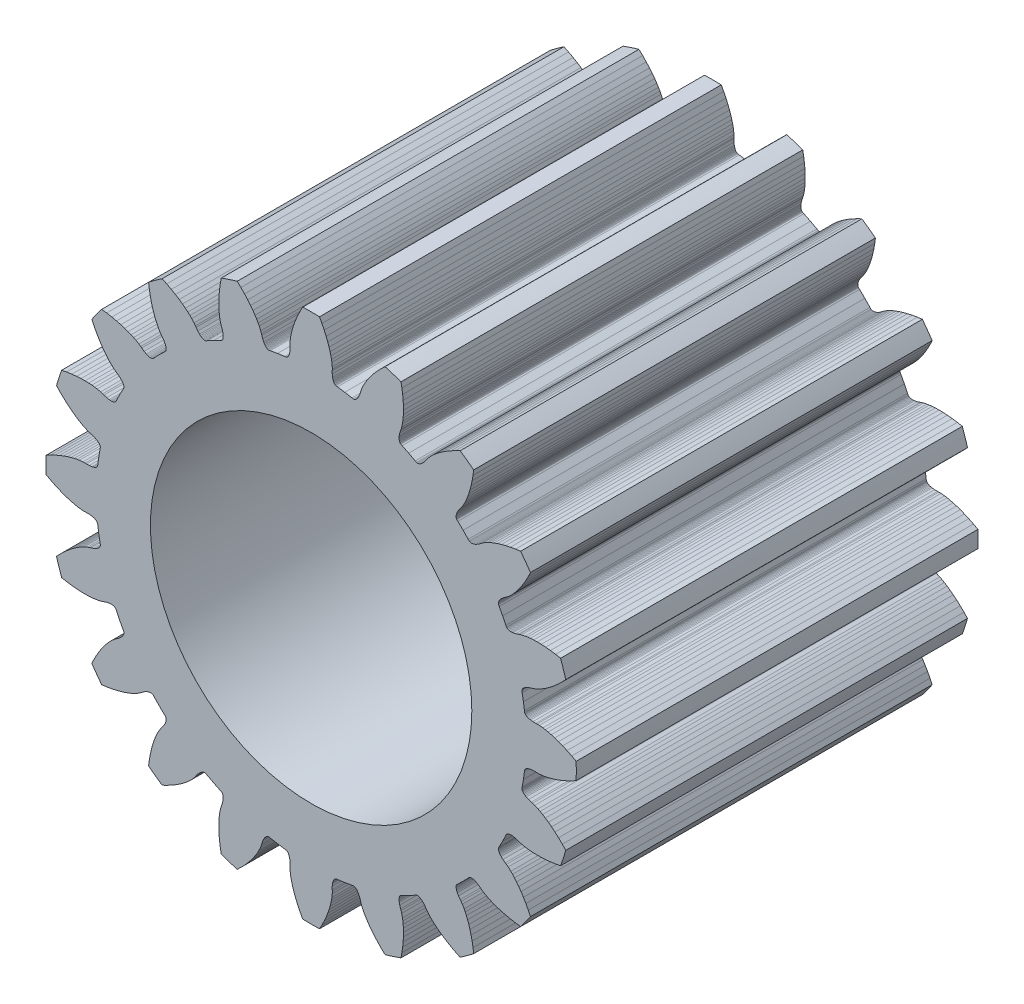
from build123d import *

# Parameters (mm, degrees)
MODEL_R             = 4
BOSS_EXTRUDE1_DEPTH = 10


with BuildPart() as part:
    # Model → Boss-Extrude1 (new body)
    with BuildSketch(Plane.XY):
        with BuildLine():
            Line((6.158306, 1.6585407), (6.2511574, 1.7486857))
            Line((6.2511574, 1.7486857), (6.338222535, 1.840329509))
            ThreePointArc((6.338222535, 1.840329509), (6.276964201, 2.03950926), (6.209448333, 2.236655815))
            Line((6.209448333, 2.236655815), (6.0851442, 2.2596217))
            Line((6.0851442, 2.2596217), (5.95704, 2.2779739))
            Line((5.95704, 2.2779739), (5.8378792, 2.2899852))
            Line((5.8378792, 2.2899852), (5.7281972, 2.2964334))
            Line((5.7281972, 2.2964334), (5.6286184, 2.2981193))
            Line((5.6286184, 2.2981193), (5.5383984, 2.295887))
            Line((5.5383984, 2.295887), (5.4581037, 2.2905413))
            Line((5.4581037, 2.2905413), (5.387621, 2.2828551))
            Line((5.387621, 2.2828551), (5.32769, 2.2737776))
            Line((5.32769, 2.2737776), (5.2396886, 2.2550103))
            Line((5.2396886, 2.2550103), (5.1873797, 2.2392778))
            Line((5.1873797, 2.2392778), (5.1564677, 2.2274555))
            Line((5.1564677, 2.2274555), (5.0880864, 2.205711))
            Line((5.0880864, 2.205711), (5.0271926, 2.1932586))
            Line((5.0271926, 2.1932586), (4.9997687, 2.1903178))
            Line((4.9997687, 2.1903178), (4.9744535, 2.189428))
            Line((4.9744535, 2.189428), (4.9513281, 2.1905181))
            Line((4.9513281, 2.1905181), (4.9304513, 2.1934947))
            Line((4.9304513, 2.1934947), (4.9119089, 2.1982555))
            Line((4.9119089, 2.1982555), (4.8957509, 2.2047026))
            Line((4.8957509, 2.2047026), (4.8820538, 2.2127515))
            Line((4.8820538, 2.2127515), (4.8708545, 2.2222864))
            Line((4.8708545, 2.2222864), (4.862234, 2.2332138))
            Line((4.862234, 2.2332138), (4.8470396, 2.2647084))
            Line((4.8470396, 2.2647084), (4.7668849, 2.4288492))
            Line((4.7668849, 2.4288492), (4.681206, 2.5901752))
            Line((4.681206, 2.5901752), (4.6646573, 2.6209798))
            Line((4.6646573, 2.6209798), (4.6608839, 2.6343769))
            Line((4.6608839, 2.6343769), (4.6597528, 2.6490418))
            Line((4.6597528, 2.6490418), (4.661292, 2.664854))
            Line((4.661292, 2.664854), (4.6655737, 2.6817156))
            Line((4.6655737, 2.6817156), (4.672621, 2.6995151))
            Line((4.672621, 2.6995151), (4.682484, 2.7181543))
            Line((4.682484, 2.7181543), (4.6951948, 2.7375039))
            Line((4.6951948, 2.7375039), (4.7107946, 2.7574613))
            Line((4.7107946, 2.7574613), (4.7292932, 2.7779192))
            Line((4.7292932, 2.7779192), (4.7751598, 2.819864))
            Line((4.7751598, 2.819864), (4.832945, 2.8624045))
            Line((4.832945, 2.8624045), (4.8606791, 2.8804639))
            Line((4.8606791, 2.8804639), (4.9041533, 2.9135354))
            Line((4.9041533, 2.9135354), (4.9710623, 2.9736988))
            Line((4.9710623, 2.9736988), (5.0136327, 3.0168484))
            Line((5.0136327, 3.0168484), (5.0612797, 3.0693523))
            Line((5.0612797, 3.0693523), (5.1128005, 3.1311699))
            Line((5.1128005, 3.1311699), (5.1676364, 3.2028473))
            Line((5.1676364, 3.2028473), (5.2248034, 3.2843992))
            Line((5.2248034, 3.2843992), (5.2840562, 3.376924))
            Line((5.2840562, 3.376924), (5.3443798, 3.4803872))
            Line((5.3443798, 3.4803872), (5.4048304, 3.5948128))
            Line((5.4048304, 3.5948128), (5.459314676, 3.708875777))
            ThreePointArc((5.459314676, 3.708875777), (5.339504611, 3.879377111), (5.214371574, 4.046011081))
            Line((5.214371574, 4.046011081), (5.0890546, 4.0294409))
            Line((5.0890546, 4.0294409), (4.9615491, 4.0073085))
            Line((4.9615491, 4.0073085), (4.8445088, 3.9819092))
            Line((4.8445088, 3.9819092), (4.7382023, 3.9541482))
            Line((4.7382023, 3.9541482), (4.6429763, 3.92498))
            Line((4.6429763, 3.92498), (4.5578618, 3.8949775))
            Line((4.5578618, 3.8949775), (4.4831489, 3.865081))
            Line((4.4831489, 3.865081), (4.4184911, 3.8359906))
            Line((4.4184911, 3.8359906), (4.3642984, 3.8088377))
            Line((4.3642984, 3.8088377), (4.2864035, 3.763795))
            Line((4.2864035, 3.763795), (4.2415164, 3.7326682))
            Line((4.2415164, 3.7326682), (4.2157706, 3.7118722))
            Line((4.2157706, 3.7118722), (4.1574555, 3.670061))
            Line((4.1574555, 3.670061), (4.1033901, 3.6394008))
            Line((4.1033901, 3.6394008), (4.0782171, 3.6281295))
            Line((4.0782171, 3.6281295), (4.0544159, 3.6194604))
            Line((4.0544159, 3.6194604), (4.0320855, 3.613351))
            Line((4.0320855, 3.613351), (4.0113107, 3.6097306))
            Line((4.0113107, 3.6097306), (3.9922047, 3.6085285))
            Line((3.9922047, 3.6085285), (3.9748452, 3.609667))
            Line((3.9748452, 3.609667), (3.9593313, 3.6130894))
            Line((3.9593313, 3.6130894), (3.9457336, 3.6186967))
            Line((3.9457336, 3.6186967), (3.9341583, 3.6264254))
            Line((3.9341583, 3.6264254), (3.9099752, 3.6516833))
            Line((3.9099752, 3.6516833), (3.7830213, 3.7830213))
            Line((3.7830213, 3.7830213), (3.6516833, 3.9099752))
            Line((3.6516833, 3.9099752), (3.6264254, 3.9341583))
            Line((3.6264254, 3.9341583), (3.6186967, 3.9457336))
            Line((3.6186967, 3.9457336), (3.6130894, 3.9593313))
            Line((3.6130894, 3.9593313), (3.609667, 3.9748452))
            Line((3.609667, 3.9748452), (3.6085285, 3.9922047))
            Line((3.6085285, 3.9922047), (3.6097306, 4.0113107))
            Line((3.6097306, 4.0113107), (3.613351, 4.0320855))
            Line((3.613351, 4.0320855), (3.6194604, 4.0544159))
            Line((3.6194604, 4.0544159), (3.6281295, 4.0782171))
            Line((3.6281295, 4.0782171), (3.6394008, 4.1033901))
            Line((3.6394008, 4.1033901), (3.670061, 4.1574555))
            Line((3.670061, 4.1574555), (3.7118722, 4.2157706))
            Line((3.7118722, 4.2157706), (3.7326682, 4.2415164))
            Line((3.7326682, 4.2415164), (3.763795, 4.2864035))
            Line((3.763795, 4.2864035), (3.8088377, 4.3642984))
            Line((3.8088377, 4.3642984), (3.8359906, 4.4184911))
            Line((3.8359906, 4.4184911), (3.865081, 4.4831489))
            Line((3.865081, 4.4831489), (3.8949775, 4.5578618))
            Line((3.8949775, 4.5578618), (3.92498, 4.6429763))
            Line((3.92498, 4.6429763), (3.9541482, 4.7382023))
            Line((3.9541482, 4.7382023), (3.9819092, 4.8445088))
            Line((3.9819092, 4.8445088), (4.0073085, 4.9615491))
            Line((4.0073085, 4.9615491), (4.0294409, 5.0890546))
            Line((4.0294409, 5.0890546), (4.046011181, 5.214371574))
            ThreePointArc((4.046011181, 5.214371574), (3.879377227, 5.339504632), (3.708875877, 5.459314676))
            Line((3.708875877, 5.459314676), (3.5948128, 5.4048304))
            Line((3.5948128, 5.4048304), (3.4803872, 5.3443798))
            Line((3.4803872, 5.3443798), (3.376924, 5.2840562))
            Line((3.376924, 5.2840562), (3.2843992, 5.2248034))
            Line((3.2843992, 5.2248034), (3.2028473, 5.1676364))
            Line((3.2028473, 5.1676364), (3.1311699, 5.1128005))
            Line((3.1311699, 5.1128005), (3.0693523, 5.0612797))
            Line((3.0693523, 5.0612797), (3.0168484, 5.0136327))
            Line((3.0168484, 5.0136327), (2.9736988, 4.9710623))
            Line((2.9736988, 4.9710623), (2.9135354, 4.9041533))
            Line((2.9135354, 4.9041533), (2.8804639, 4.8606791))
            Line((2.8804639, 4.8606791), (2.8624045, 4.832945))
            Line((2.8624045, 4.832945), (2.819864, 4.7751598))
            Line((2.819864, 4.7751598), (2.7779192, 4.7292932))
            Line((2.7779192, 4.7292932), (2.7574613, 4.7107946))
            Line((2.7574613, 4.7107946), (2.7375039, 4.6951948))
            Line((2.7375039, 4.6951948), (2.7181543, 4.682484))
            Line((2.7181543, 4.682484), (2.6995151, 4.672621))
            Line((2.6995151, 4.672621), (2.6817156, 4.6655737))
            Line((2.6817156, 4.6655737), (2.664854, 4.661292))
            Line((2.664854, 4.661292), (2.6490418, 4.6597528))
            Line((2.6490418, 4.6597528), (2.6343769, 4.6608839))
            Line((2.6343769, 4.6608839), (2.6209798, 4.6646573))
            Line((2.6209798, 4.6646573), (2.5901752, 4.681206))
            Line((2.5901752, 4.681206), (2.4288492, 4.7668849))
            Line((2.4288492, 4.7668849), (2.2647084, 4.8470396))
            Line((2.2647084, 4.8470396), (2.2332138, 4.862234))
            Line((2.2332138, 4.862234), (2.2222864, 4.8708545))
            Line((2.2222864, 4.8708545), (2.2127515, 4.8820538))
            Line((2.2127515, 4.8820538), (2.2047026, 4.8957509))
            Line((2.2047026, 4.8957509), (2.1982555, 4.9119089))
            Line((2.1982555, 4.9119089), (2.1934947, 4.9304513))
            Line((2.1934947, 4.9304513), (2.1905181, 4.9513281))
            Line((2.1905181, 4.9513281), (2.189428, 4.9744535))
            Line((2.189428, 4.9744535), (2.1903178, 4.9997687))
            Line((2.1903178, 4.9997687), (2.1932586, 5.0271926))
            Line((2.1932586, 5.0271926), (2.205711, 5.0880864))
            Line((2.205711, 5.0880864), (2.2274555, 5.1564677))
            Line((2.2274555, 5.1564677), (2.2392778, 5.1873797))
            Line((2.2392778, 5.1873797), (2.2550103, 5.2396886))
            Line((2.2550103, 5.2396886), (2.2737776, 5.32769))
            Line((2.2737776, 5.32769), (2.2828551, 5.387621))
            Line((2.2828551, 5.387621), (2.2905413, 5.4581037))
            Line((2.2905413, 5.4581037), (2.295887, 5.5383984))
            Line((2.295887, 5.5383984), (2.2981193, 5.6286184))
            Line((2.2981193, 5.6286184), (2.2964334, 5.7281972))
            Line((2.2964334, 5.7281972), (2.2899852, 5.8378792))
            Line((2.2899852, 5.8378792), (2.2779739, 5.95704))
            Line((2.2779739, 5.95704), (2.2596217, 6.0851442))
            Line((2.2596217, 6.0851442), (2.236655915, 6.209448333))
            ThreePointArc((2.236655915, 6.209448333), (2.039509367, 6.276964221), (1.840329609, 6.338222535))
            Line((1.840329609, 6.338222535), (1.7486857, 6.2511574))
            Line((1.7486857, 6.2511574), (1.6585407, 6.158306))
            Line((1.6585407, 6.158306), (1.5787824, 6.068963))
            Line((1.5787824, 6.068963), (1.5090962, 5.9840185))
            Line((1.5090962, 5.9840185), (1.4492013, 5.9044485))
            Line((1.4492013, 5.9044485), (1.3979773, 5.8301469))
            Line((1.3979773, 5.8301469), (1.355106, 5.762045))
            Line((1.355106, 5.762045), (1.3198956, 5.7005055))
            Line((1.3198956, 5.7005055), (1.2920129, 5.6466847))
            Line((1.2920129, 5.6466847), (1.2554701, 5.5644589))
            Line((1.2554701, 5.5644589), (1.2374515, 5.5128928))
            Line((1.2374515, 5.5128928), (1.2288463, 5.4809355))
            Line((1.2288463, 5.4809355), (1.2062445, 5.4128327))
            Line((1.2062445, 5.4128327), (1.1805262, 5.3562493))
            Line((1.1805262, 5.3562493), (1.1667859, 5.3323343))
            Line((1.1667859, 5.3323343), (1.1526259, 5.3113309))
            Line((1.1526259, 5.3113309), (1.1381513, 5.2932628))
            Line((1.1381513, 5.2932628), (1.1234721, 5.2781227))
            Line((1.1234721, 5.2781227), (1.1087216, 5.2659199))
            Line((1.1087216, 5.2659199), (1.0940083, 5.2566373))
            Line((1.0940083, 5.2566373), (1.0794456, 5.2502872))
            Line((1.0794456, 5.2502872), (1.065149, 5.2468312))
            Line((1.065149, 5.2468312), (1.0512415, 5.24628))
            Line((1.0512415, 5.24628), (1.0168308, 5.2524996))
            Line((1.0168308, 5.2524996), (0.8369244, 5.2841326))
            Line((0.8369244, 5.2841326), (0.656048, 5.309642))
            Line((0.656048, 5.309642), (0.6213996, 5.3143603))
            Line((0.6213996, 5.3143603), (0.6083431, 5.3191821))
            Line((0.6083431, 5.3191821), (0.5958142, 5.3268869))
            Line((0.5958142, 5.3268869), (0.5839265, 5.3374263))
            Line((0.5839265, 5.3374263), (0.5728019, 5.3508013))
            Line((0.5728019, 5.3508013), (0.5625441, 5.366965))
            Line((0.5625441, 5.366965), (0.553262, 5.3859001))
            Line((0.553262, 5.3859001), (0.5450791, 5.4075568))
            Line((0.5450791, 5.4075568), (0.5381026, 5.431908))
            Line((0.5381026, 5.431908), (0.5324249, 5.4588985))
            Line((0.5324249, 5.4588985), (0.5254506, 5.5206599))
            Line((0.5254506, 5.5206599), (0.5249999, 5.5924138))
            Line((0.5249999, 5.5924138), (0.5266912, 5.6254662))
            Line((0.5266912, 5.6254662), (0.5254894, 5.6800765))
            Line((0.5254894, 5.6800765), (0.5161442, 5.7695702))
            Line((0.5161442, 5.7695702), (0.5062577, 5.8293731))
            Line((0.5062577, 5.8293731), (0.4917874, 5.8987813))
            Line((0.4917874, 5.8987813), (0.472059, 5.976798))
            Line((0.472059, 5.976798), (0.4463026, 6.0632921))
            Line((0.4463026, 6.0632921), (0.4139276, 6.1574762))
            Line((0.4139276, 6.1574762), (0.3739014, 6.2597974))
            Line((0.3739014, 6.2597974), (0.3256553, 6.3694144))
            Line((0.3256553, 6.3694144), (0.268615, 6.4855776))
            Line((0.268615, 6.4855776), (0.208361095, 6.596700914))
            ThreePointArc((0.208361095, 6.596700914), (4.6e-08, 6.599990705), (-0.208361003, 6.596700917))
            Line((-0.208361003, 6.596700917), (-0.268615, 6.4855776))
            Line((-0.268615, 6.4855776), (-0.3256553, 6.3694144))
            Line((-0.3256553, 6.3694144), (-0.3739014, 6.2597974))
            Line((-0.3739014, 6.2597974), (-0.4139276, 6.1574762))
            Line((-0.4139276, 6.1574762), (-0.4463026, 6.0632921))
            Line((-0.4463026, 6.0632921), (-0.472059, 5.976798))
            Line((-0.472059, 5.976798), (-0.4917874, 5.8987813))
            Line((-0.4917874, 5.8987813), (-0.5062577, 5.8293731))
            Line((-0.5062577, 5.8293731), (-0.5161442, 5.7695702))
            Line((-0.5161442, 5.7695702), (-0.5254894, 5.6800765))
            Line((-0.5254894, 5.6800765), (-0.5266912, 5.6254662))
            Line((-0.5266912, 5.6254662), (-0.5249999, 5.5924138))
            Line((-0.5249999, 5.5924138), (-0.5254506, 5.5206599))
            Line((-0.5254506, 5.5206599), (-0.5324249, 5.4588985))
            Line((-0.5324249, 5.4588985), (-0.5381026, 5.431908))
            Line((-0.5381026, 5.431908), (-0.5450791, 5.4075568))
            Line((-0.5450791, 5.4075568), (-0.553262, 5.3859001))
            Line((-0.553262, 5.3859001), (-0.5625441, 5.366965))
            Line((-0.5625441, 5.366965), (-0.5728019, 5.3508013))
            Line((-0.5728019, 5.3508013), (-0.5839265, 5.3374263))
            Line((-0.5839265, 5.3374263), (-0.5958142, 5.3268869))
            Line((-0.5958142, 5.3268869), (-0.6083431, 5.3191821))
            Line((-0.6083431, 5.3191821), (-0.6213996, 5.3143603))
            Line((-0.6213996, 5.3143603), (-0.656048, 5.309642))
            Line((-0.656048, 5.309642), (-0.8369244, 5.2841326))
            Line((-0.8369244, 5.2841326), (-1.0168308, 5.2524996))
            Line((-1.0168308, 5.2524996), (-1.0512415, 5.24628))
            Line((-1.0512415, 5.24628), (-1.065149, 5.2468312))
            Line((-1.065149, 5.2468312), (-1.0794456, 5.2502872))
            Line((-1.0794456, 5.2502872), (-1.0940083, 5.2566373))
            Line((-1.0940083, 5.2566373), (-1.1087216, 5.2659199))
            Line((-1.1087216, 5.2659199), (-1.1234721, 5.2781227))
            Line((-1.1234721, 5.2781227), (-1.1381513, 5.2932628))
            Line((-1.1381513, 5.2932628), (-1.1526259, 5.3113309))
            Line((-1.1526259, 5.3113309), (-1.1667859, 5.3323343))
            Line((-1.1667859, 5.3323343), (-1.1805262, 5.3562493))
            Line((-1.1805262, 5.3562493), (-1.2062445, 5.4128327))
            Line((-1.2062445, 5.4128327), (-1.2288463, 5.4809355))
            Line((-1.2288463, 5.4809355), (-1.2374515, 5.5128928))
            Line((-1.2374515, 5.5128928), (-1.2554701, 5.5644589))
            Line((-1.2554701, 5.5644589), (-1.2920129, 5.6466847))
            Line((-1.2920129, 5.6466847), (-1.3198956, 5.7005055))
            Line((-1.3198956, 5.7005055), (-1.355106, 5.762045))
            Line((-1.355106, 5.762045), (-1.3979773, 5.8301469))
            Line((-1.3979773, 5.8301469), (-1.4492013, 5.9044485))
            Line((-1.4492013, 5.9044485), (-1.5090962, 5.9840185))
            Line((-1.5090962, 5.9840185), (-1.5787824, 6.068963))
            Line((-1.5787824, 6.068963), (-1.6585407, 6.158306))
            Line((-1.6585407, 6.158306), (-1.7486857, 6.2511574))
            Line((-1.7486857, 6.2511574), (-1.840329509, 6.338222535))
            ThreePointArc((-1.840329509, 6.338222535), (-2.03950926, 6.276964201), (-2.236655815, 6.209448333))
            Line((-2.236655815, 6.209448333), (-2.2596217, 6.0851442))
            Line((-2.2596217, 6.0851442), (-2.2779739, 5.95704))
            Line((-2.2779739, 5.95704), (-2.2899852, 5.8378792))
            Line((-2.2899852, 5.8378792), (-2.2964334, 5.7281972))
            Line((-2.2964334, 5.7281972), (-2.2981193, 5.6286184))
            Line((-2.2981193, 5.6286184), (-2.295887, 5.5383984))
            Line((-2.295887, 5.5383984), (-2.2905413, 5.4581037))
            Line((-2.2905413, 5.4581037), (-2.2828551, 5.387621))
            Line((-2.2828551, 5.387621), (-2.2737776, 5.32769))
            Line((-2.2737776, 5.32769), (-2.2550103, 5.2396886))
            Line((-2.2550103, 5.2396886), (-2.2392778, 5.1873797))
            Line((-2.2392778, 5.1873797), (-2.2274555, 5.1564677))
            Line((-2.2274555, 5.1564677), (-2.205711, 5.0880864))
            Line((-2.205711, 5.0880864), (-2.1932586, 5.0271926))
            Line((-2.1932586, 5.0271926), (-2.1903178, 4.9997687))
            Line((-2.1903178, 4.9997687), (-2.189428, 4.9744535))
            Line((-2.189428, 4.9744535), (-2.1905181, 4.9513281))
            Line((-2.1905181, 4.9513281), (-2.1934947, 4.9304513))
            Line((-2.1934947, 4.9304513), (-2.1982555, 4.9119089))
            Line((-2.1982555, 4.9119089), (-2.2047026, 4.8957509))
            Line((-2.2047026, 4.8957509), (-2.2127515, 4.8820538))
            Line((-2.2127515, 4.8820538), (-2.2222864, 4.8708545))
            Line((-2.2222864, 4.8708545), (-2.2332138, 4.862234))
            Line((-2.2332138, 4.862234), (-2.2647084, 4.8470396))
            Line((-2.2647084, 4.8470396), (-2.4288492, 4.7668849))
            Line((-2.4288492, 4.7668849), (-2.5901752, 4.681206))
            Line((-2.5901752, 4.681206), (-2.6209798, 4.6646573))
            Line((-2.6209798, 4.6646573), (-2.6343769, 4.6608839))
            Line((-2.6343769, 4.6608839), (-2.6490418, 4.6597528))
            Line((-2.6490418, 4.6597528), (-2.664854, 4.661292))
            Line((-2.664854, 4.661292), (-2.6817156, 4.6655737))
            Line((-2.6817156, 4.6655737), (-2.6995151, 4.672621))
            Line((-2.6995151, 4.672621), (-2.7181543, 4.682484))
            Line((-2.7181543, 4.682484), (-2.7375039, 4.6951948))
            Line((-2.7375039, 4.6951948), (-2.7574613, 4.7107946))
            Line((-2.7574613, 4.7107946), (-2.7779192, 4.7292932))
            Line((-2.7779192, 4.7292932), (-2.819864, 4.7751598))
            Line((-2.819864, 4.7751598), (-2.8624045, 4.832945))
            Line((-2.8624045, 4.832945), (-2.8804639, 4.8606791))
            Line((-2.8804639, 4.8606791), (-2.9135354, 4.9041533))
            Line((-2.9135354, 4.9041533), (-2.9736988, 4.9710623))
            Line((-2.9736988, 4.9710623), (-3.0168484, 5.0136327))
            Line((-3.0168484, 5.0136327), (-3.0693523, 5.0612797))
            Line((-3.0693523, 5.0612797), (-3.1311699, 5.1128005))
            Line((-3.1311699, 5.1128005), (-3.2028473, 5.1676364))
            Line((-3.2028473, 5.1676364), (-3.2843992, 5.2248034))
            Line((-3.2843992, 5.2248034), (-3.376924, 5.2840562))
            Line((-3.376924, 5.2840562), (-3.4803872, 5.3443798))
            Line((-3.4803872, 5.3443798), (-3.5948128, 5.4048304))
            Line((-3.5948128, 5.4048304), (-3.708875777, 5.459314676))
            ThreePointArc((-3.708875777, 5.459314676), (-3.879377111, 5.339504611), (-4.046011081, 5.214371574))
            Line((-4.046011081, 5.214371574), (-4.0294409, 5.0890546))
            Line((-4.0294409, 5.0890546), (-4.0073085, 4.9615491))
            Line((-4.0073085, 4.9615491), (-3.9819092, 4.8445088))
            Line((-3.9819092, 4.8445088), (-3.9541482, 4.7382023))
            Line((-3.9541482, 4.7382023), (-3.92498, 4.6429763))
            Line((-3.92498, 4.6429763), (-3.8949775, 4.5578618))
            Line((-3.8949775, 4.5578618), (-3.865081, 4.4831489))
            Line((-3.865081, 4.4831489), (-3.8359906, 4.4184911))
            Line((-3.8359906, 4.4184911), (-3.8088377, 4.3642984))
            Line((-3.8088377, 4.3642984), (-3.763795, 4.2864035))
            Line((-3.763795, 4.2864035), (-3.7326682, 4.2415164))
            Line((-3.7326682, 4.2415164), (-3.7118722, 4.2157706))
            Line((-3.7118722, 4.2157706), (-3.670061, 4.1574555))
            Line((-3.670061, 4.1574555), (-3.6394008, 4.1033901))
            Line((-3.6394008, 4.1033901), (-3.6281295, 4.0782171))
            Line((-3.6281295, 4.0782171), (-3.6194604, 4.0544159))
            Line((-3.6194604, 4.0544159), (-3.613351, 4.0320855))
            Line((-3.613351, 4.0320855), (-3.6097306, 4.0113107))
            Line((-3.6097306, 4.0113107), (-3.6085285, 3.9922047))
            Line((-3.6085285, 3.9922047), (-3.609667, 3.9748452))
            Line((-3.609667, 3.9748452), (-3.6130894, 3.9593313))
            Line((-3.6130894, 3.9593313), (-3.6186967, 3.9457336))
            Line((-3.6186967, 3.9457336), (-3.6264254, 3.9341583))
            Line((-3.6264254, 3.9341583), (-3.6516833, 3.9099752))
            Line((-3.6516833, 3.9099752), (-3.7830213, 3.7830213))
            Line((-3.7830213, 3.7830213), (-3.9099752, 3.6516833))
            Line((-3.9099752, 3.6516833), (-3.9341583, 3.6264254))
            Line((-3.9341583, 3.6264254), (-3.9457336, 3.6186967))
            Line((-3.9457336, 3.6186967), (-3.9593313, 3.6130894))
            Line((-3.9593313, 3.6130894), (-3.9748452, 3.609667))
            Line((-3.9748452, 3.609667), (-3.9922047, 3.6085285))
            Line((-3.9922047, 3.6085285), (-4.0113107, 3.6097306))
            Line((-4.0113107, 3.6097306), (-4.0320855, 3.613351))
            Line((-4.0320855, 3.613351), (-4.0544159, 3.6194604))
            Line((-4.0544159, 3.6194604), (-4.0782171, 3.6281295))
            Line((-4.0782171, 3.6281295), (-4.1033901, 3.6394008))
            Line((-4.1033901, 3.6394008), (-4.1574555, 3.670061))
            Line((-4.1574555, 3.670061), (-4.2157706, 3.7118722))
            Line((-4.2157706, 3.7118722), (-4.2415164, 3.7326682))
            Line((-4.2415164, 3.7326682), (-4.2864035, 3.763795))
            Line((-4.2864035, 3.763795), (-4.3642984, 3.8088377))
            Line((-4.3642984, 3.8088377), (-4.4184911, 3.8359906))
            Line((-4.4184911, 3.8359906), (-4.4831489, 3.865081))
            Line((-4.4831489, 3.865081), (-4.5578618, 3.8949775))
            Line((-4.5578618, 3.8949775), (-4.6429763, 3.92498))
            Line((-4.6429763, 3.92498), (-4.7382023, 3.9541482))
            Line((-4.7382023, 3.9541482), (-4.8445088, 3.9819092))
            Line((-4.8445088, 3.9819092), (-4.9615491, 4.0073085))
            Line((-4.9615491, 4.0073085), (-5.0890546, 4.0294409))
            Line((-5.0890546, 4.0294409), (-5.214371574, 4.046011181))
            ThreePointArc((-5.214371574, 4.046011181), (-5.339504632, 3.879377227), (-5.459314676, 3.708875877))
            Line((-5.459314676, 3.708875877), (-5.4048304, 3.5948128))
            Line((-5.4048304, 3.5948128), (-5.3443798, 3.4803872))
            Line((-5.3443798, 3.4803872), (-5.2840562, 3.376924))
            Line((-5.2840562, 3.376924), (-5.2248034, 3.2843992))
            Line((-5.2248034, 3.2843992), (-5.1676364, 3.2028473))
            Line((-5.1676364, 3.2028473), (-5.1128005, 3.1311699))
            Line((-5.1128005, 3.1311699), (-5.0612797, 3.0693523))
            Line((-5.0612797, 3.0693523), (-5.0136327, 3.0168484))
            Line((-5.0136327, 3.0168484), (-4.9710623, 2.9736988))
            Line((-4.9710623, 2.9736988), (-4.9041533, 2.9135354))
            Line((-4.9041533, 2.9135354), (-4.8606791, 2.8804639))
            Line((-4.8606791, 2.8804639), (-4.832945, 2.8624045))
            Line((-4.832945, 2.8624045), (-4.7751598, 2.819864))
            Line((-4.7751598, 2.819864), (-4.7292932, 2.7779192))
            Line((-4.7292932, 2.7779192), (-4.7107946, 2.7574613))
            Line((-4.7107946, 2.7574613), (-4.6951948, 2.7375039))
            Line((-4.6951948, 2.7375039), (-4.682484, 2.7181543))
            Line((-4.682484, 2.7181543), (-4.672621, 2.6995151))
            Line((-4.672621, 2.6995151), (-4.6655737, 2.6817156))
            Line((-4.6655737, 2.6817156), (-4.661292, 2.664854))
            Line((-4.661292, 2.664854), (-4.6597528, 2.6490418))
            Line((-4.6597528, 2.6490418), (-4.6608839, 2.6343769))
            Line((-4.6608839, 2.6343769), (-4.6646573, 2.6209798))
            Line((-4.6646573, 2.6209798), (-4.681206, 2.5901752))
            Line((-4.681206, 2.5901752), (-4.7668849, 2.4288492))
            Line((-4.7668849, 2.4288492), (-4.8470396, 2.2647084))
            Line((-4.8470396, 2.2647084), (-4.862234, 2.2332138))
            Line((-4.862234, 2.2332138), (-4.8708545, 2.2222864))
            Line((-4.8708545, 2.2222864), (-4.8820538, 2.2127515))
            Line((-4.8820538, 2.2127515), (-4.8957509, 2.2047026))
            Line((-4.8957509, 2.2047026), (-4.9119089, 2.1982555))
            Line((-4.9119089, 2.1982555), (-4.9304513, 2.1934947))
            Line((-4.9304513, 2.1934947), (-4.9513281, 2.1905181))
            Line((-4.9513281, 2.1905181), (-4.9744535, 2.189428))
            Line((-4.9744535, 2.189428), (-4.9997687, 2.1903178))
            Line((-4.9997687, 2.1903178), (-5.0271926, 2.1932586))
            Line((-5.0271926, 2.1932586), (-5.0880864, 2.205711))
            Line((-5.0880864, 2.205711), (-5.1564677, 2.2274555))
            Line((-5.1564677, 2.2274555), (-5.1873797, 2.2392778))
            Line((-5.1873797, 2.2392778), (-5.2396886, 2.2550103))
            Line((-5.2396886, 2.2550103), (-5.32769, 2.2737776))
            Line((-5.32769, 2.2737776), (-5.387621, 2.2828551))
            Line((-5.387621, 2.2828551), (-5.4581037, 2.2905413))
            Line((-5.4581037, 2.2905413), (-5.5383984, 2.295887))
            Line((-5.5383984, 2.295887), (-5.6286184, 2.2981193))
            Line((-5.6286184, 2.2981193), (-5.7281972, 2.2964334))
            Line((-5.7281972, 2.2964334), (-5.8378792, 2.2899852))
            Line((-5.8378792, 2.2899852), (-5.95704, 2.2779739))
            Line((-5.95704, 2.2779739), (-6.0851442, 2.2596217))
            Line((-6.0851442, 2.2596217), (-6.209448333, 2.236655915))
            ThreePointArc((-6.209448333, 2.236655915), (-6.276964221, 2.039509367), (-6.338222535, 1.840329609))
            Line((-6.338222535, 1.840329609), (-6.2511574, 1.7486857))
            Line((-6.2511574, 1.7486857), (-6.158306, 1.6585407))
            Line((-6.158306, 1.6585407), (-6.068963, 1.5787824))
            Line((-6.068963, 1.5787824), (-5.9840185, 1.5090962))
            Line((-5.9840185, 1.5090962), (-5.9044485, 1.4492013))
            Line((-5.9044485, 1.4492013), (-5.8301469, 1.3979773))
            Line((-5.8301469, 1.3979773), (-5.762045, 1.355106))
            Line((-5.762045, 1.355106), (-5.7005055, 1.3198956))
            Line((-5.7005055, 1.3198956), (-5.6466847, 1.2920129))
            Line((-5.6466847, 1.2920129), (-5.5644589, 1.2554701))
            Line((-5.5644589, 1.2554701), (-5.5128928, 1.2374515))
            Line((-5.5128928, 1.2374515), (-5.4809355, 1.2288463))
            Line((-5.4809355, 1.2288463), (-5.4128327, 1.2062445))
            Line((-5.4128327, 1.2062445), (-5.3562493, 1.1805262))
            Line((-5.3562493, 1.1805262), (-5.3323343, 1.1667859))
            Line((-5.3323343, 1.1667859), (-5.3113309, 1.1526259))
            Line((-5.3113309, 1.1526259), (-5.2932628, 1.1381513))
            Line((-5.2932628, 1.1381513), (-5.2781227, 1.1234721))
            Line((-5.2781227, 1.1234721), (-5.2659199, 1.1087216))
            Line((-5.2659199, 1.1087216), (-5.2566373, 1.0940083))
            Line((-5.2566373, 1.0940083), (-5.2502872, 1.0794456))
            Line((-5.2502872, 1.0794456), (-5.2468312, 1.065149))
            Line((-5.2468312, 1.065149), (-5.24628, 1.0512415))
            Line((-5.24628, 1.0512415), (-5.2524996, 1.0168308))
            Line((-5.2524996, 1.0168308), (-5.2841326, 0.8369244))
            Line((-5.2841326, 0.8369244), (-5.309642, 0.656048))
            Line((-5.309642, 0.656048), (-5.3143603, 0.6213996))
            Line((-5.3143603, 0.6213996), (-5.3191821, 0.6083431))
            Line((-5.3191821, 0.6083431), (-5.3268869, 0.5958142))
            Line((-5.3268869, 0.5958142), (-5.3374263, 0.5839265))
            Line((-5.3374263, 0.5839265), (-5.3508013, 0.5728019))
            Line((-5.3508013, 0.5728019), (-5.366965, 0.5625441))
            Line((-5.366965, 0.5625441), (-5.3859001, 0.553262))
            Line((-5.3859001, 0.553262), (-5.4075568, 0.5450791))
            Line((-5.4075568, 0.5450791), (-5.431908, 0.5381026))
            Line((-5.431908, 0.5381026), (-5.4588985, 0.5324249))
            Line((-5.4588985, 0.5324249), (-5.5206599, 0.5254506))
            Line((-5.5206599, 0.5254506), (-5.5924138, 0.5249999))
            Line((-5.5924138, 0.5249999), (-5.6254662, 0.5266912))
            Line((-5.6254662, 0.5266912), (-5.6800765, 0.5254894))
            Line((-5.6800765, 0.5254894), (-5.7695702, 0.5161442))
            Line((-5.7695702, 0.5161442), (-5.8293731, 0.5062577))
            Line((-5.8293731, 0.5062577), (-5.8987813, 0.4917874))
            Line((-5.8987813, 0.4917874), (-5.976798, 0.472059))
            Line((-5.976798, 0.472059), (-6.0632921, 0.4463026))
            Line((-6.0632921, 0.4463026), (-6.1574762, 0.4139276))
            Line((-6.1574762, 0.4139276), (-6.2597974, 0.3739014))
            Line((-6.2597974, 0.3739014), (-6.3694144, 0.3256553))
            Line((-6.3694144, 0.3256553), (-6.4855776, 0.268615))
            Line((-6.4855776, 0.268615), (-6.596700914, 0.208361095))
            ThreePointArc((-6.596700914, 0.208361095), (-6.599990705, 4.6e-08), (-6.596700917, -0.208361003))
            Line((-6.596700917, -0.208361003), (-6.4855776, -0.268615))
            Line((-6.4855776, -0.268615), (-6.3694144, -0.3256553))
            Line((-6.3694144, -0.3256553), (-6.2597974, -0.3739014))
            Line((-6.2597974, -0.3739014), (-6.1574762, -0.4139276))
            Line((-6.1574762, -0.4139276), (-6.0632921, -0.4463026))
            Line((-6.0632921, -0.4463026), (-5.976798, -0.472059))
            Line((-5.976798, -0.472059), (-5.8987813, -0.4917874))
            Line((-5.8987813, -0.4917874), (-5.8293731, -0.5062577))
            Line((-5.8293731, -0.5062577), (-5.7695702, -0.5161442))
            Line((-5.7695702, -0.5161442), (-5.6800765, -0.5254894))
            Line((-5.6800765, -0.5254894), (-5.6254662, -0.5266912))
            Line((-5.6254662, -0.5266912), (-5.5924138, -0.5249999))
            Line((-5.5924138, -0.5249999), (-5.5206599, -0.5254506))
            Line((-5.5206599, -0.5254506), (-5.4588985, -0.5324249))
            Line((-5.4588985, -0.5324249), (-5.431908, -0.5381026))
            Line((-5.431908, -0.5381026), (-5.4075568, -0.5450791))
            Line((-5.4075568, -0.5450791), (-5.3859001, -0.553262))
            Line((-5.3859001, -0.553262), (-5.366965, -0.5625441))
            Line((-5.366965, -0.5625441), (-5.3508013, -0.5728019))
            Line((-5.3508013, -0.5728019), (-5.3374263, -0.5839265))
            Line((-5.3374263, -0.5839265), (-5.3268869, -0.5958142))
            Line((-5.3268869, -0.5958142), (-5.3191821, -0.6083431))
            Line((-5.3191821, -0.6083431), (-5.3143603, -0.6213996))
            Line((-5.3143603, -0.6213996), (-5.309642, -0.656048))
            Line((-5.309642, -0.656048), (-5.2841326, -0.8369244))
            Line((-5.2841326, -0.8369244), (-5.2524996, -1.0168308))
            Line((-5.2524996, -1.0168308), (-5.24628, -1.0512415))
            Line((-5.24628, -1.0512415), (-5.2468312, -1.065149))
            Line((-5.2468312, -1.065149), (-5.2502872, -1.0794456))
            Line((-5.2502872, -1.0794456), (-5.2566373, -1.0940083))
            Line((-5.2566373, -1.0940083), (-5.2659199, -1.1087216))
            Line((-5.2659199, -1.1087216), (-5.2781227, -1.1234721))
            Line((-5.2781227, -1.1234721), (-5.2932628, -1.1381513))
            Line((-5.2932628, -1.1381513), (-5.3113309, -1.1526259))
            Line((-5.3113309, -1.1526259), (-5.3323343, -1.1667859))
            Line((-5.3323343, -1.1667859), (-5.3562493, -1.1805262))
            Line((-5.3562493, -1.1805262), (-5.4128327, -1.2062445))
            Line((-5.4128327, -1.2062445), (-5.4809355, -1.2288463))
            Line((-5.4809355, -1.2288463), (-5.5128928, -1.2374515))
            Line((-5.5128928, -1.2374515), (-5.5644589, -1.2554701))
            Line((-5.5644589, -1.2554701), (-5.6466847, -1.2920129))
            Line((-5.6466847, -1.2920129), (-5.7005055, -1.3198956))
            Line((-5.7005055, -1.3198956), (-5.762045, -1.355106))
            Line((-5.762045, -1.355106), (-5.8301469, -1.3979773))
            Line((-5.8301469, -1.3979773), (-5.9044485, -1.4492013))
            Line((-5.9044485, -1.4492013), (-5.9840185, -1.5090962))
            Line((-5.9840185, -1.5090962), (-6.068963, -1.5787824))
            Line((-6.068963, -1.5787824), (-6.158306, -1.6585407))
            Line((-6.158306, -1.6585407), (-6.2511574, -1.7486857))
            Line((-6.2511574, -1.7486857), (-6.338222535, -1.840329509))
            ThreePointArc((-6.338222535, -1.840329509), (-6.276964201, -2.03950926), (-6.209448333, -2.236655815))
            Line((-6.209448333, -2.236655815), (-6.0851442, -2.2596217))
            Line((-6.0851442, -2.2596217), (-5.95704, -2.2779739))
            Line((-5.95704, -2.2779739), (-5.8378792, -2.2899852))
            Line((-5.8378792, -2.2899852), (-5.7281972, -2.2964334))
            Line((-5.7281972, -2.2964334), (-5.6286184, -2.2981193))
            Line((-5.6286184, -2.2981193), (-5.5383984, -2.295887))
            Line((-5.5383984, -2.295887), (-5.4581037, -2.2905413))
            Line((-5.4581037, -2.2905413), (-5.387621, -2.2828551))
            Line((-5.387621, -2.2828551), (-5.32769, -2.2737776))
            Line((-5.32769, -2.2737776), (-5.2396886, -2.2550103))
            Line((-5.2396886, -2.2550103), (-5.1873797, -2.2392778))
            Line((-5.1873797, -2.2392778), (-5.1564677, -2.2274555))
            Line((-5.1564677, -2.2274555), (-5.0880864, -2.205711))
            Line((-5.0880864, -2.205711), (-5.0271926, -2.1932586))
            Line((-5.0271926, -2.1932586), (-4.9997687, -2.1903178))
            Line((-4.9997687, -2.1903178), (-4.9744535, -2.189428))
            Line((-4.9744535, -2.189428), (-4.9513281, -2.1905181))
            Line((-4.9513281, -2.1905181), (-4.9304513, -2.1934947))
            Line((-4.9304513, -2.1934947), (-4.9119089, -2.1982555))
            Line((-4.9119089, -2.1982555), (-4.8957509, -2.2047026))
            Line((-4.8957509, -2.2047026), (-4.8820538, -2.2127515))
            Line((-4.8820538, -2.2127515), (-4.8708545, -2.2222864))
            Line((-4.8708545, -2.2222864), (-4.862234, -2.2332138))
            Line((-4.862234, -2.2332138), (-4.8470396, -2.2647084))
            Line((-4.8470396, -2.2647084), (-4.7668849, -2.4288492))
            Line((-4.7668849, -2.4288492), (-4.681206, -2.5901752))
            Line((-4.681206, -2.5901752), (-4.6646573, -2.6209798))
            Line((-4.6646573, -2.6209798), (-4.6608839, -2.6343769))
            Line((-4.6608839, -2.6343769), (-4.6597528, -2.6490418))
            Line((-4.6597528, -2.6490418), (-4.661292, -2.664854))
            Line((-4.661292, -2.664854), (-4.6655737, -2.6817156))
            Line((-4.6655737, -2.6817156), (-4.672621, -2.6995151))
            Line((-4.672621, -2.6995151), (-4.682484, -2.7181543))
            Line((-4.682484, -2.7181543), (-4.6951948, -2.7375039))
            Line((-4.6951948, -2.7375039), (-4.7107946, -2.7574613))
            Line((-4.7107946, -2.7574613), (-4.7292932, -2.7779192))
            Line((-4.7292932, -2.7779192), (-4.7751598, -2.819864))
            Line((-4.7751598, -2.819864), (-4.832945, -2.8624045))
            Line((-4.832945, -2.8624045), (-4.8606791, -2.8804639))
            Line((-4.8606791, -2.8804639), (-4.9041533, -2.9135354))
            Line((-4.9041533, -2.9135354), (-4.9710623, -2.9736988))
            Line((-4.9710623, -2.9736988), (-5.0136327, -3.0168484))
            Line((-5.0136327, -3.0168484), (-5.0612797, -3.0693523))
            Line((-5.0612797, -3.0693523), (-5.1128005, -3.1311699))
            Line((-5.1128005, -3.1311699), (-5.1676364, -3.2028473))
            Line((-5.1676364, -3.2028473), (-5.2248034, -3.2843992))
            Line((-5.2248034, -3.2843992), (-5.2840562, -3.376924))
            Line((-5.2840562, -3.376924), (-5.3443798, -3.4803872))
            Line((-5.3443798, -3.4803872), (-5.4048304, -3.5948128))
            Line((-5.4048304, -3.5948128), (-5.459314676, -3.708875777))
            ThreePointArc((-5.459314676, -3.708875777), (-5.339504611, -3.879377111), (-5.214371574, -4.046011081))
            Line((-5.214371574, -4.046011081), (-5.0890546, -4.0294409))
            Line((-5.0890546, -4.0294409), (-4.9615491, -4.0073085))
            Line((-4.9615491, -4.0073085), (-4.8445088, -3.9819092))
            Line((-4.8445088, -3.9819092), (-4.7382023, -3.9541482))
            Line((-4.7382023, -3.9541482), (-4.6429763, -3.92498))
            Line((-4.6429763, -3.92498), (-4.5578618, -3.8949775))
            Line((-4.5578618, -3.8949775), (-4.4831489, -3.865081))
            Line((-4.4831489, -3.865081), (-4.4184911, -3.8359906))
            Line((-4.4184911, -3.8359906), (-4.3642984, -3.8088377))
            Line((-4.3642984, -3.8088377), (-4.2864035, -3.763795))
            Line((-4.2864035, -3.763795), (-4.2415164, -3.7326682))
            Line((-4.2415164, -3.7326682), (-4.2157706, -3.7118722))
            Line((-4.2157706, -3.7118722), (-4.1574555, -3.670061))
            Line((-4.1574555, -3.670061), (-4.1033901, -3.6394008))
            Line((-4.1033901, -3.6394008), (-4.0782171, -3.6281295))
            Line((-4.0782171, -3.6281295), (-4.0544159, -3.6194604))
            Line((-4.0544159, -3.6194604), (-4.0320855, -3.613351))
            Line((-4.0320855, -3.613351), (-4.0113107, -3.6097306))
            Line((-4.0113107, -3.6097306), (-3.9922047, -3.6085285))
            Line((-3.9922047, -3.6085285), (-3.9748452, -3.609667))
            Line((-3.9748452, -3.609667), (-3.9593313, -3.6130894))
            Line((-3.9593313, -3.6130894), (-3.9457336, -3.6186967))
            Line((-3.9457336, -3.6186967), (-3.9341583, -3.6264254))
            Line((-3.9341583, -3.6264254), (-3.9099752, -3.6516833))
            Line((-3.9099752, -3.6516833), (-3.7830213, -3.7830213))
            Line((-3.7830213, -3.7830213), (-3.6516833, -3.9099752))
            Line((-3.6516833, -3.9099752), (-3.6264254, -3.9341583))
            Line((-3.6264254, -3.9341583), (-3.6186967, -3.9457336))
            Line((-3.6186967, -3.9457336), (-3.6130894, -3.9593313))
            Line((-3.6130894, -3.9593313), (-3.609667, -3.9748452))
            Line((-3.609667, -3.9748452), (-3.6085285, -3.9922047))
            Line((-3.6085285, -3.9922047), (-3.6097306, -4.0113107))
            Line((-3.6097306, -4.0113107), (-3.613351, -4.0320855))
            Line((-3.613351, -4.0320855), (-3.6194604, -4.0544159))
            Line((-3.6194604, -4.0544159), (-3.6281295, -4.0782171))
            Line((-3.6281295, -4.0782171), (-3.6394008, -4.1033901))
            Line((-3.6394008, -4.1033901), (-3.670061, -4.1574555))
            Line((-3.670061, -4.1574555), (-3.7118722, -4.2157706))
            Line((-3.7118722, -4.2157706), (-3.7326682, -4.2415164))
            Line((-3.7326682, -4.2415164), (-3.763795, -4.2864035))
            Line((-3.763795, -4.2864035), (-3.8088377, -4.3642984))
            Line((-3.8088377, -4.3642984), (-3.8359906, -4.4184911))
            Line((-3.8359906, -4.4184911), (-3.865081, -4.4831489))
            Line((-3.865081, -4.4831489), (-3.8949775, -4.5578618))
            Line((-3.8949775, -4.5578618), (-3.92498, -4.6429763))
            Line((-3.92498, -4.6429763), (-3.9541482, -4.7382023))
            Line((-3.9541482, -4.7382023), (-3.9819092, -4.8445088))
            Line((-3.9819092, -4.8445088), (-4.0073085, -4.9615491))
            Line((-4.0073085, -4.9615491), (-4.0294409, -5.0890546))
            Line((-4.0294409, -5.0890546), (-4.046011181, -5.214371574))
            ThreePointArc((-4.046011181, -5.214371574), (-3.879377227, -5.339504632), (-3.708875877, -5.459314676))
            Line((-3.708875877, -5.459314676), (-3.5948128, -5.4048304))
            Line((-3.5948128, -5.4048304), (-3.4803872, -5.3443798))
            Line((-3.4803872, -5.3443798), (-3.376924, -5.2840562))
            Line((-3.376924, -5.2840562), (-3.2843992, -5.2248034))
            Line((-3.2843992, -5.2248034), (-3.2028473, -5.1676364))
            Line((-3.2028473, -5.1676364), (-3.1311699, -5.1128005))
            Line((-3.1311699, -5.1128005), (-3.0693523, -5.0612797))
            Line((-3.0693523, -5.0612797), (-3.0168484, -5.0136327))
            Line((-3.0168484, -5.0136327), (-2.9736988, -4.9710623))
            Line((-2.9736988, -4.9710623), (-2.9135354, -4.9041533))
            Line((-2.9135354, -4.9041533), (-2.8804639, -4.8606791))
            Line((-2.8804639, -4.8606791), (-2.8624045, -4.832945))
            Line((-2.8624045, -4.832945), (-2.819864, -4.7751598))
            Line((-2.819864, -4.7751598), (-2.7779192, -4.7292932))
            Line((-2.7779192, -4.7292932), (-2.7574613, -4.7107946))
            Line((-2.7574613, -4.7107946), (-2.7375039, -4.6951948))
            Line((-2.7375039, -4.6951948), (-2.7181543, -4.682484))
            Line((-2.7181543, -4.682484), (-2.6995151, -4.672621))
            Line((-2.6995151, -4.672621), (-2.6817156, -4.6655737))
            Line((-2.6817156, -4.6655737), (-2.664854, -4.661292))
            Line((-2.664854, -4.661292), (-2.6490418, -4.6597528))
            Line((-2.6490418, -4.6597528), (-2.6343769, -4.6608839))
            Line((-2.6343769, -4.6608839), (-2.6209798, -4.6646573))
            Line((-2.6209798, -4.6646573), (-2.5901752, -4.681206))
            Line((-2.5901752, -4.681206), (-2.4288492, -4.7668849))
            Line((-2.4288492, -4.7668849), (-2.2647084, -4.8470396))
            Line((-2.2647084, -4.8470396), (-2.2332138, -4.862234))
            Line((-2.2332138, -4.862234), (-2.2222864, -4.8708545))
            Line((-2.2222864, -4.8708545), (-2.2127515, -4.8820538))
            Line((-2.2127515, -4.8820538), (-2.2047026, -4.8957509))
            Line((-2.2047026, -4.8957509), (-2.1982555, -4.9119089))
            Line((-2.1982555, -4.9119089), (-2.1934947, -4.9304513))
            Line((-2.1934947, -4.9304513), (-2.1905181, -4.9513281))
            Line((-2.1905181, -4.9513281), (-2.189428, -4.9744535))
            Line((-2.189428, -4.9744535), (-2.1903178, -4.9997687))
            Line((-2.1903178, -4.9997687), (-2.1932586, -5.0271926))
            Line((-2.1932586, -5.0271926), (-2.205711, -5.0880864))
            Line((-2.205711, -5.0880864), (-2.2274555, -5.1564677))
            Line((-2.2274555, -5.1564677), (-2.2392778, -5.1873797))
            Line((-2.2392778, -5.1873797), (-2.2550103, -5.2396886))
            Line((-2.2550103, -5.2396886), (-2.2737776, -5.32769))
            Line((-2.2737776, -5.32769), (-2.2828551, -5.387621))
            Line((-2.2828551, -5.387621), (-2.2905413, -5.4581037))
            Line((-2.2905413, -5.4581037), (-2.295887, -5.5383984))
            Line((-2.295887, -5.5383984), (-2.2981193, -5.6286184))
            Line((-2.2981193, -5.6286184), (-2.2964334, -5.7281972))
            Line((-2.2964334, -5.7281972), (-2.2899852, -5.8378792))
            Line((-2.2899852, -5.8378792), (-2.2779739, -5.95704))
            Line((-2.2779739, -5.95704), (-2.2596217, -6.0851442))
            Line((-2.2596217, -6.0851442), (-2.236655915, -6.209448333))
            ThreePointArc((-2.236655915, -6.209448333), (-2.039509367, -6.276964221), (-1.840329609, -6.338222535))
            Line((-1.840329609, -6.338222535), (-1.7486857, -6.2511574))
            Line((-1.7486857, -6.2511574), (-1.6585407, -6.158306))
            Line((-1.6585407, -6.158306), (-1.5787824, -6.068963))
            Line((-1.5787824, -6.068963), (-1.5090962, -5.9840185))
            Line((-1.5090962, -5.9840185), (-1.4492013, -5.9044485))
            Line((-1.4492013, -5.9044485), (-1.3979773, -5.8301469))
            Line((-1.3979773, -5.8301469), (-1.355106, -5.762045))
            Line((-1.355106, -5.762045), (-1.3198956, -5.7005055))
            Line((-1.3198956, -5.7005055), (-1.2920129, -5.6466847))
            Line((-1.2920129, -5.6466847), (-1.2554701, -5.5644589))
            Line((-1.2554701, -5.5644589), (-1.2374515, -5.5128928))
            Line((-1.2374515, -5.5128928), (-1.2288463, -5.4809355))
            Line((-1.2288463, -5.4809355), (-1.2062445, -5.4128327))
            Line((-1.2062445, -5.4128327), (-1.1805262, -5.3562493))
            Line((-1.1805262, -5.3562493), (-1.1667859, -5.3323343))
            Line((-1.1667859, -5.3323343), (-1.1526259, -5.3113309))
            Line((-1.1526259, -5.3113309), (-1.1381513, -5.2932628))
            Line((-1.1381513, -5.2932628), (-1.1234721, -5.2781227))
            Line((-1.1234721, -5.2781227), (-1.1087216, -5.2659199))
            Line((-1.1087216, -5.2659199), (-1.0940083, -5.2566373))
            Line((-1.0940083, -5.2566373), (-1.0794456, -5.2502872))
            Line((-1.0794456, -5.2502872), (-1.065149, -5.2468312))
            Line((-1.065149, -5.2468312), (-1.0512415, -5.24628))
            Line((-1.0512415, -5.24628), (-1.0168308, -5.2524996))
            Line((-1.0168308, -5.2524996), (-0.8369244, -5.2841326))
            Line((-0.8369244, -5.2841326), (-0.656048, -5.309642))
            Line((-0.656048, -5.309642), (-0.6213996, -5.3143603))
            Line((-0.6213996, -5.3143603), (-0.6083431, -5.3191821))
            Line((-0.6083431, -5.3191821), (-0.5958142, -5.3268869))
            Line((-0.5958142, -5.3268869), (-0.5839265, -5.3374263))
            Line((-0.5839265, -5.3374263), (-0.5728019, -5.3508013))
            Line((-0.5728019, -5.3508013), (-0.5625441, -5.366965))
            Line((-0.5625441, -5.366965), (-0.553262, -5.3859001))
            Line((-0.553262, -5.3859001), (-0.5450791, -5.4075568))
            Line((-0.5450791, -5.4075568), (-0.5381026, -5.431908))
            Line((-0.5381026, -5.431908), (-0.5324249, -5.4588985))
            Line((-0.5324249, -5.4588985), (-0.5254506, -5.5206599))
            Line((-0.5254506, -5.5206599), (-0.5249999, -5.5924138))
            Line((-0.5249999, -5.5924138), (-0.5266912, -5.6254662))
            Line((-0.5266912, -5.6254662), (-0.5254894, -5.6800765))
            Line((-0.5254894, -5.6800765), (-0.5161442, -5.7695702))
            Line((-0.5161442, -5.7695702), (-0.5062577, -5.8293731))
            Line((-0.5062577, -5.8293731), (-0.4917874, -5.8987813))
            Line((-0.4917874, -5.8987813), (-0.472059, -5.976798))
            Line((-0.472059, -5.976798), (-0.4463026, -6.0632921))
            Line((-0.4463026, -6.0632921), (-0.4139276, -6.1574762))
            Line((-0.4139276, -6.1574762), (-0.3739014, -6.2597974))
            Line((-0.3739014, -6.2597974), (-0.3256553, -6.3694144))
            Line((-0.3256553, -6.3694144), (-0.268615, -6.4855776))
            Line((-0.268615, -6.4855776), (-0.208361095, -6.596700914))
            ThreePointArc((-0.208361095, -6.596700914), (-4.6e-08, -6.599990705), (0.208361003, -6.596700917))
            Line((0.208361003, -6.596700917), (0.268615, -6.4855776))
            Line((0.268615, -6.4855776), (0.3256553, -6.3694144))
            Line((0.3256553, -6.3694144), (0.3739014, -6.2597974))
            Line((0.3739014, -6.2597974), (0.4139276, -6.1574762))
            Line((0.4139276, -6.1574762), (0.4463026, -6.0632921))
            Line((0.4463026, -6.0632921), (0.472059, -5.976798))
            Line((0.472059, -5.976798), (0.4917874, -5.8987813))
            Line((0.4917874, -5.8987813), (0.5062577, -5.8293731))
            Line((0.5062577, -5.8293731), (0.5161442, -5.7695702))
            Line((0.5161442, -5.7695702), (0.5254894, -5.6800765))
            Line((0.5254894, -5.6800765), (0.5266912, -5.6254662))
            Line((0.5266912, -5.6254662), (0.5249999, -5.5924138))
            Line((0.5249999, -5.5924138), (0.5254506, -5.5206599))
            Line((0.5254506, -5.5206599), (0.5324249, -5.4588985))
            Line((0.5324249, -5.4588985), (0.5381026, -5.431908))
            Line((0.5381026, -5.431908), (0.5450791, -5.4075568))
            Line((0.5450791, -5.4075568), (0.553262, -5.3859001))
            Line((0.553262, -5.3859001), (0.5625441, -5.366965))
            Line((0.5625441, -5.366965), (0.5728019, -5.3508013))
            Line((0.5728019, -5.3508013), (0.5839265, -5.3374263))
            Line((0.5839265, -5.3374263), (0.5958142, -5.3268869))
            Line((0.5958142, -5.3268869), (0.6083431, -5.3191821))
            Line((0.6083431, -5.3191821), (0.6213996, -5.3143603))
            Line((0.6213996, -5.3143603), (0.656048, -5.309642))
            Line((0.656048, -5.309642), (0.8369244, -5.2841326))
            Line((0.8369244, -5.2841326), (1.0168308, -5.2524996))
            Line((1.0168308, -5.2524996), (1.0512415, -5.24628))
            Line((1.0512415, -5.24628), (1.065149, -5.2468312))
            Line((1.065149, -5.2468312), (1.0794456, -5.2502872))
            Line((1.0794456, -5.2502872), (1.0940083, -5.2566373))
            Line((1.0940083, -5.2566373), (1.1087216, -5.2659199))
            Line((1.1087216, -5.2659199), (1.1234721, -5.2781227))
            Line((1.1234721, -5.2781227), (1.1381513, -5.2932628))
            Line((1.1381513, -5.2932628), (1.1526259, -5.3113309))
            Line((1.1526259, -5.3113309), (1.1667859, -5.3323343))
            Line((1.1667859, -5.3323343), (1.1805262, -5.3562493))
            Line((1.1805262, -5.3562493), (1.2062445, -5.4128327))
            Line((1.2062445, -5.4128327), (1.2288463, -5.4809355))
            Line((1.2288463, -5.4809355), (1.2374515, -5.5128928))
            Line((1.2374515, -5.5128928), (1.2554701, -5.5644589))
            Line((1.2554701, -5.5644589), (1.2920129, -5.6466847))
            Line((1.2920129, -5.6466847), (1.3198956, -5.7005055))
            Line((1.3198956, -5.7005055), (1.355106, -5.762045))
            Line((1.355106, -5.762045), (1.3979773, -5.8301469))
            Line((1.3979773, -5.8301469), (1.4492013, -5.9044485))
            Line((1.4492013, -5.9044485), (1.5090962, -5.9840185))
            Line((1.5090962, -5.9840185), (1.5787824, -6.068963))
            Line((1.5787824, -6.068963), (1.6585407, -6.158306))
            Line((1.6585407, -6.158306), (1.7486857, -6.2511574))
            Line((1.7486857, -6.2511574), (1.840329509, -6.338222535))
            ThreePointArc((1.840329509, -6.338222535), (2.03950926, -6.276964201), (2.236655815, -6.209448333))
            Line((2.236655815, -6.209448333), (2.2596217, -6.0851442))
            Line((2.2596217, -6.0851442), (2.2779739, -5.95704))
            Line((2.2779739, -5.95704), (2.2899852, -5.8378792))
            Line((2.2899852, -5.8378792), (2.2964334, -5.7281972))
            Line((2.2964334, -5.7281972), (2.2981193, -5.6286184))
            Line((2.2981193, -5.6286184), (2.295887, -5.5383984))
            Line((2.295887, -5.5383984), (2.2905413, -5.4581037))
            Line((2.2905413, -5.4581037), (2.2828551, -5.387621))
            Line((2.2828551, -5.387621), (2.2737776, -5.32769))
            Line((2.2737776, -5.32769), (2.2550103, -5.2396886))
            Line((2.2550103, -5.2396886), (2.2392778, -5.1873797))
            Line((2.2392778, -5.1873797), (2.2274555, -5.1564677))
            Line((2.2274555, -5.1564677), (2.205711, -5.0880864))
            Line((2.205711, -5.0880864), (2.1932586, -5.0271926))
            Line((2.1932586, -5.0271926), (2.1903178, -4.9997687))
            Line((2.1903178, -4.9997687), (2.189428, -4.9744535))
            Line((2.189428, -4.9744535), (2.1905181, -4.9513281))
            Line((2.1905181, -4.9513281), (2.1934947, -4.9304513))
            Line((2.1934947, -4.9304513), (2.1982555, -4.9119089))
            Line((2.1982555, -4.9119089), (2.2047026, -4.8957509))
            Line((2.2047026, -4.8957509), (2.2127515, -4.8820538))
            Line((2.2127515, -4.8820538), (2.2222864, -4.8708545))
            Line((2.2222864, -4.8708545), (2.2332138, -4.862234))
            Line((2.2332138, -4.862234), (2.2647084, -4.8470396))
            Line((2.2647084, -4.8470396), (2.4288492, -4.7668849))
            Line((2.4288492, -4.7668849), (2.5901752, -4.681206))
            Line((2.5901752, -4.681206), (2.6209798, -4.6646573))
            Line((2.6209798, -4.6646573), (2.6343769, -4.6608839))
            Line((2.6343769, -4.6608839), (2.6490418, -4.6597528))
            Line((2.6490418, -4.6597528), (2.664854, -4.661292))
            Line((2.664854, -4.661292), (2.6817156, -4.6655737))
            Line((2.6817156, -4.6655737), (2.6995151, -4.672621))
            Line((2.6995151, -4.672621), (2.7181543, -4.682484))
            Line((2.7181543, -4.682484), (2.7375039, -4.6951948))
            Line((2.7375039, -4.6951948), (2.7574613, -4.7107946))
            Line((2.7574613, -4.7107946), (2.7779192, -4.7292932))
            Line((2.7779192, -4.7292932), (2.819864, -4.7751598))
            Line((2.819864, -4.7751598), (2.8624045, -4.832945))
            Line((2.8624045, -4.832945), (2.8804639, -4.8606791))
            Line((2.8804639, -4.8606791), (2.9135354, -4.9041533))
            Line((2.9135354, -4.9041533), (2.9736988, -4.9710623))
            Line((2.9736988, -4.9710623), (3.0168484, -5.0136327))
            Line((3.0168484, -5.0136327), (3.0693523, -5.0612797))
            Line((3.0693523, -5.0612797), (3.1311699, -5.1128005))
            Line((3.1311699, -5.1128005), (3.2028473, -5.1676364))
            Line((3.2028473, -5.1676364), (3.2843992, -5.2248034))
            Line((3.2843992, -5.2248034), (3.376924, -5.2840562))
            Line((3.376924, -5.2840562), (3.4803872, -5.3443798))
            Line((3.4803872, -5.3443798), (3.5948128, -5.4048304))
            Line((3.5948128, -5.4048304), (3.708875777, -5.459314676))
            ThreePointArc((3.708875777, -5.459314676), (3.879377111, -5.339504611), (4.046011081, -5.214371574))
            Line((4.046011081, -5.214371574), (4.0294409, -5.0890546))
            Line((4.0294409, -5.0890546), (4.0073085, -4.9615491))
            Line((4.0073085, -4.9615491), (3.9819092, -4.8445088))
            Line((3.9819092, -4.8445088), (3.9541482, -4.7382023))
            Line((3.9541482, -4.7382023), (3.92498, -4.6429763))
            Line((3.92498, -4.6429763), (3.8949775, -4.5578618))
            Line((3.8949775, -4.5578618), (3.865081, -4.4831489))
            Line((3.865081, -4.4831489), (3.8359906, -4.4184911))
            Line((3.8359906, -4.4184911), (3.8088377, -4.3642984))
            Line((3.8088377, -4.3642984), (3.763795, -4.2864035))
            Line((3.763795, -4.2864035), (3.7326682, -4.2415164))
            Line((3.7326682, -4.2415164), (3.7118722, -4.2157706))
            Line((3.7118722, -4.2157706), (3.670061, -4.1574555))
            Line((3.670061, -4.1574555), (3.6394008, -4.1033901))
            Line((3.6394008, -4.1033901), (3.6281295, -4.0782171))
            Line((3.6281295, -4.0782171), (3.6194604, -4.0544159))
            Line((3.6194604, -4.0544159), (3.613351, -4.0320855))
            Line((3.613351, -4.0320855), (3.6097306, -4.0113107))
            Line((3.6097306, -4.0113107), (3.6085285, -3.9922047))
            Line((3.6085285, -3.9922047), (3.609667, -3.9748452))
            Line((3.609667, -3.9748452), (3.6130894, -3.9593313))
            Line((3.6130894, -3.9593313), (3.6186967, -3.9457336))
            Line((3.6186967, -3.9457336), (3.6264254, -3.9341583))
            Line((3.6264254, -3.9341583), (3.6516833, -3.9099752))
            Line((3.6516833, -3.9099752), (3.7830213, -3.7830213))
            Line((3.7830213, -3.7830213), (3.9099752, -3.6516833))
            Line((3.9099752, -3.6516833), (3.9341583, -3.6264254))
            Line((3.9341583, -3.6264254), (3.9457336, -3.6186967))
            Line((3.9457336, -3.6186967), (3.9593313, -3.6130894))
            Line((3.9593313, -3.6130894), (3.9748452, -3.609667))
            Line((3.9748452, -3.609667), (3.9922047, -3.6085285))
            Line((3.9922047, -3.6085285), (4.0113107, -3.6097306))
            Line((4.0113107, -3.6097306), (4.0320855, -3.613351))
            Line((4.0320855, -3.613351), (4.0544159, -3.6194604))
            Line((4.0544159, -3.6194604), (4.0782171, -3.6281295))
            Line((4.0782171, -3.6281295), (4.1033901, -3.6394008))
            Line((4.1033901, -3.6394008), (4.1574555, -3.670061))
            Line((4.1574555, -3.670061), (4.2157706, -3.7118722))
            Line((4.2157706, -3.7118722), (4.2415164, -3.7326682))
            Line((4.2415164, -3.7326682), (4.2864035, -3.763795))
            Line((4.2864035, -3.763795), (4.3642984, -3.8088377))
            Line((4.3642984, -3.8088377), (4.4184911, -3.8359906))
            Line((4.4184911, -3.8359906), (4.4831489, -3.865081))
            Line((4.4831489, -3.865081), (4.5578618, -3.8949775))
            Line((4.5578618, -3.8949775), (4.6429763, -3.92498))
            Line((4.6429763, -3.92498), (4.7382023, -3.9541482))
            Line((4.7382023, -3.9541482), (4.8445088, -3.9819092))
            Line((4.8445088, -3.9819092), (4.9615491, -4.0073085))
            Line((4.9615491, -4.0073085), (5.0890546, -4.0294409))
            Line((5.0890546, -4.0294409), (5.214371574, -4.046011181))
            ThreePointArc((5.214371574, -4.046011181), (5.339504632, -3.879377227), (5.459314676, -3.708875877))
            Line((5.459314676, -3.708875877), (5.4048304, -3.5948128))
            Line((5.4048304, -3.5948128), (5.3443798, -3.4803872))
            Line((5.3443798, -3.4803872), (5.2840562, -3.376924))
            Line((5.2840562, -3.376924), (5.2248034, -3.2843992))
            Line((5.2248034, -3.2843992), (5.1676364, -3.2028473))
            Line((5.1676364, -3.2028473), (5.1128005, -3.1311699))
            Line((5.1128005, -3.1311699), (5.0612797, -3.0693523))
            Line((5.0612797, -3.0693523), (5.0136327, -3.0168484))
            Line((5.0136327, -3.0168484), (4.9710623, -2.9736988))
            Line((4.9710623, -2.9736988), (4.9041533, -2.9135354))
            Line((4.9041533, -2.9135354), (4.8606791, -2.8804639))
            Line((4.8606791, -2.8804639), (4.832945, -2.8624045))
            Line((4.832945, -2.8624045), (4.7751598, -2.819864))
            Line((4.7751598, -2.819864), (4.7292932, -2.7779192))
            Line((4.7292932, -2.7779192), (4.7107946, -2.7574613))
            Line((4.7107946, -2.7574613), (4.6951948, -2.7375039))
            Line((4.6951948, -2.7375039), (4.682484, -2.7181543))
            Line((4.682484, -2.7181543), (4.672621, -2.6995151))
            Line((4.672621, -2.6995151), (4.6655737, -2.6817156))
            Line((4.6655737, -2.6817156), (4.661292, -2.664854))
            Line((4.661292, -2.664854), (4.6597528, -2.6490418))
            Line((4.6597528, -2.6490418), (4.6608839, -2.6343769))
            Line((4.6608839, -2.6343769), (4.6646573, -2.6209798))
            Line((4.6646573, -2.6209798), (4.681206, -2.5901752))
            Line((4.681206, -2.5901752), (4.7668849, -2.4288492))
            Line((4.7668849, -2.4288492), (4.8470396, -2.2647084))
            Line((4.8470396, -2.2647084), (4.862234, -2.2332138))
            Line((4.862234, -2.2332138), (4.8708545, -2.2222864))
            Line((4.8708545, -2.2222864), (4.8820538, -2.2127515))
            Line((4.8820538, -2.2127515), (4.8957509, -2.2047026))
            Line((4.8957509, -2.2047026), (4.9119089, -2.1982555))
            Line((4.9119089, -2.1982555), (4.9304513, -2.1934947))
            Line((4.9304513, -2.1934947), (4.9513281, -2.1905181))
            Line((4.9513281, -2.1905181), (4.9744535, -2.189428))
            Line((4.9744535, -2.189428), (4.9997687, -2.1903178))
            Line((4.9997687, -2.1903178), (5.0271926, -2.1932586))
            Line((5.0271926, -2.1932586), (5.0880864, -2.205711))
            Line((5.0880864, -2.205711), (5.1564677, -2.2274555))
            Line((5.1564677, -2.2274555), (5.1873797, -2.2392778))
            Line((5.1873797, -2.2392778), (5.2396886, -2.2550103))
            Line((5.2396886, -2.2550103), (5.32769, -2.2737776))
            Line((5.32769, -2.2737776), (5.387621, -2.2828551))
            Line((5.387621, -2.2828551), (5.4581037, -2.2905413))
            Line((5.4581037, -2.2905413), (5.5383984, -2.295887))
            Line((5.5383984, -2.295887), (5.6286184, -2.2981193))
            Line((5.6286184, -2.2981193), (5.7281972, -2.2964334))
            Line((5.7281972, -2.2964334), (5.8378792, -2.2899852))
            Line((5.8378792, -2.2899852), (5.95704, -2.2779739))
            Line((5.95704, -2.2779739), (6.0851442, -2.2596217))
            Line((6.0851442, -2.2596217), (6.209448333, -2.236655915))
            ThreePointArc((6.209448333, -2.236655915), (6.276964221, -2.039509367), (6.338222535, -1.840329609))
            Line((6.338222535, -1.840329609), (6.2511574, -1.7486857))
            Line((6.2511574, -1.7486857), (6.158306, -1.6585407))
            Line((6.158306, -1.6585407), (6.068963, -1.5787824))
            Line((6.068963, -1.5787824), (5.9840185, -1.5090962))
            Line((5.9840185, -1.5090962), (5.9044485, -1.4492013))
            Line((5.9044485, -1.4492013), (5.8301469, -1.3979773))
            Line((5.8301469, -1.3979773), (5.762045, -1.355106))
            Line((5.762045, -1.355106), (5.7005055, -1.3198956))
            Line((5.7005055, -1.3198956), (5.6466847, -1.2920129))
            Line((5.6466847, -1.2920129), (5.5644589, -1.2554701))
            Line((5.5644589, -1.2554701), (5.5128928, -1.2374515))
            Line((5.5128928, -1.2374515), (5.4809355, -1.2288463))
            Line((5.4809355, -1.2288463), (5.4128327, -1.2062445))
            Line((5.4128327, -1.2062445), (5.3562493, -1.1805262))
            Line((5.3562493, -1.1805262), (5.3323343, -1.1667859))
            Line((5.3323343, -1.1667859), (5.3113309, -1.1526259))
            Line((5.3113309, -1.1526259), (5.2932628, -1.1381513))
            Line((5.2932628, -1.1381513), (5.2781227, -1.1234721))
            Line((5.2781227, -1.1234721), (5.2659199, -1.1087216))
            Line((5.2659199, -1.1087216), (5.2566373, -1.0940083))
            Line((5.2566373, -1.0940083), (5.2502872, -1.0794456))
            Line((5.2502872, -1.0794456), (5.2468312, -1.065149))
            Line((5.2468312, -1.065149), (5.24628, -1.0512415))
            Line((5.24628, -1.0512415), (5.2524996, -1.0168308))
            Line((5.2524996, -1.0168308), (5.2841326, -0.8369244))
            Line((5.2841326, -0.8369244), (5.309642, -0.656048))
            Line((5.309642, -0.656048), (5.3143603, -0.6213996))
            Line((5.3143603, -0.6213996), (5.3191821, -0.6083431))
            Line((5.3191821, -0.6083431), (5.3268869, -0.5958142))
            Line((5.3268869, -0.5958142), (5.3374263, -0.5839265))
            Line((5.3374263, -0.5839265), (5.3508013, -0.5728019))
            Line((5.3508013, -0.5728019), (5.366965, -0.5625441))
            Line((5.366965, -0.5625441), (5.3859001, -0.553262))
            Line((5.3859001, -0.553262), (5.4075568, -0.5450791))
            Line((5.4075568, -0.5450791), (5.431908, -0.5381026))
            Line((5.431908, -0.5381026), (5.4588985, -0.5324249))
            Line((5.4588985, -0.5324249), (5.5206599, -0.5254506))
            Line((5.5206599, -0.5254506), (5.5924138, -0.5249999))
            Line((5.5924138, -0.5249999), (5.6254662, -0.5266912))
            Line((5.6254662, -0.5266912), (5.6800765, -0.5254894))
            Line((5.6800765, -0.5254894), (5.7695702, -0.5161442))
            Line((5.7695702, -0.5161442), (5.8293731, -0.5062577))
            Line((5.8293731, -0.5062577), (5.8987813, -0.4917874))
            Line((5.8987813, -0.4917874), (5.976798, -0.472059))
            Line((5.976798, -0.472059), (6.0632921, -0.4463026))
            Line((6.0632921, -0.4463026), (6.1574762, -0.4139276))
            Line((6.1574762, -0.4139276), (6.2597974, -0.3739014))
            Line((6.2597974, -0.3739014), (6.3694144, -0.3256553))
            Line((6.3694144, -0.3256553), (6.4855776, -0.268615))
            Line((6.4855776, -0.268615), (6.596700914, -0.208361095))
            ThreePointArc((6.596700914, -0.208361095), (6.599990705, -4.6e-08), (6.596700917, 0.208361003))
            Line((6.596700917, 0.208361003), (6.4855776, 0.268615))
            Line((6.4855776, 0.268615), (6.3694144, 0.3256553))
            Line((6.3694144, 0.3256553), (6.2597974, 0.3739014))
            Line((6.2597974, 0.3739014), (6.1574762, 0.4139276))
            Line((6.1574762, 0.4139276), (6.0632921, 0.4463026))
            Line((6.0632921, 0.4463026), (5.976798, 0.472059))
            Line((5.976798, 0.472059), (5.8987813, 0.4917874))
            Line((5.8987813, 0.4917874), (5.8293731, 0.5062577))
            Line((5.8293731, 0.5062577), (5.7695702, 0.5161442))
            Line((5.7695702, 0.5161442), (5.6800765, 0.5254894))
            Line((5.6800765, 0.5254894), (5.6254662, 0.5266912))
            Line((5.6254662, 0.5266912), (5.5924138, 0.5249999))
            Line((5.5924138, 0.5249999), (5.5206599, 0.5254506))
            Line((5.5206599, 0.5254506), (5.4588985, 0.5324249))
            Line((5.4588985, 0.5324249), (5.431908, 0.5381026))
            Line((5.431908, 0.5381026), (5.4075568, 0.5450791))
            Line((5.4075568, 0.5450791), (5.3859001, 0.553262))
            Line((5.3859001, 0.553262), (5.366965, 0.5625441))
            Line((5.366965, 0.5625441), (5.3508013, 0.5728019))
            Line((5.3508013, 0.5728019), (5.3374263, 0.5839265))
            Line((5.3374263, 0.5839265), (5.3268869, 0.5958142))
            Line((5.3268869, 0.5958142), (5.3191821, 0.6083431))
            Line((5.3191821, 0.6083431), (5.3143603, 0.6213996))
            Line((5.3143603, 0.6213996), (5.309642, 0.656048))
            Line((5.309642, 0.656048), (5.2841326, 0.8369244))
            Line((5.2841326, 0.8369244), (5.2524996, 1.0168308))
            Line((5.2524996, 1.0168308), (5.24628, 1.0512415))
            Line((5.24628, 1.0512415), (5.2468312, 1.065149))
            Line((5.2468312, 1.065149), (5.2502872, 1.0794456))
            Line((5.2502872, 1.0794456), (5.2566373, 1.0940083))
            Line((5.2566373, 1.0940083), (5.2659199, 1.1087216))
            Line((5.2659199, 1.1087216), (5.2781227, 1.1234721))
            Line((5.2781227, 1.1234721), (5.2932628, 1.1381513))
            Line((5.2932628, 1.1381513), (5.3113309, 1.1526259))
            Line((5.3113309, 1.1526259), (5.3323343, 1.1667859))
            Line((5.3323343, 1.1667859), (5.3562493, 1.1805262))
            Line((5.3562493, 1.1805262), (5.4128327, 1.2062445))
            Line((5.4128327, 1.2062445), (5.4809355, 1.2288463))
            Line((5.4809355, 1.2288463), (5.5128928, 1.2374515))
            Line((5.5128928, 1.2374515), (5.5644589, 1.2554701))
            Line((5.5644589, 1.2554701), (5.6466847, 1.2920129))
            Line((5.6466847, 1.2920129), (5.7005055, 1.3198956))
            Line((5.7005055, 1.3198956), (5.762045, 1.355106))
            Line((5.762045, 1.355106), (5.8301469, 1.3979773))
            Line((5.8301469, 1.3979773), (5.9044485, 1.4492013))
            Line((5.9044485, 1.4492013), (5.9840185, 1.5090962))
            Line((5.9840185, 1.5090962), (6.068963, 1.5787824))
            Line((6.068963, 1.5787824), (6.158306, 1.6585407))
        make_face()
        Circle(MODEL_R, mode=Mode.SUBTRACT)
    extrude(amount=BOSS_EXTRUDE1_DEPTH)


solid = part.part
